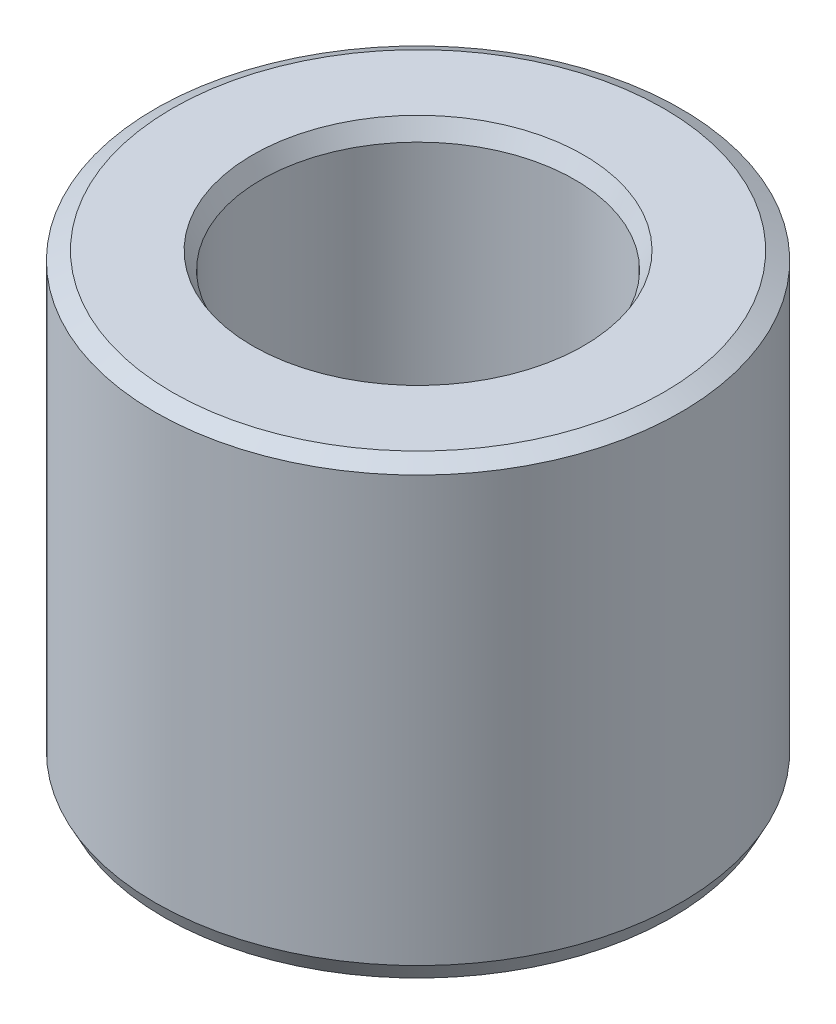
from build123d import *
from OCP.BRepFilletAPI import BRepFilletAPI_MakeChamfer

# Parameters (mm, degrees)
SKETCH1_R           = 40
BOSS_EXTRUDE1_DEPTH = 68.575934322
SKETCH2_R           = 23.842682264
CUT_EXTRUDE1_DEPTH  = 89.896899654
CHAMFER1_SIZE       = 1.338896725
CHAMFER1_SIZE2      = 2.590322023


with BuildPart() as part:
    # Sketch1 → Boss-Extrude1 (new body)
    with BuildSketch(Plane(origin=(0, 0, 0), x_dir=(1, 0, 0), z_dir=(0, 1, 0))):
        Circle(SKETCH1_R)
    extrude(amount=BOSS_EXTRUDE1_DEPTH)

    # Sketch2 → Cut-Extrude1 (cut, through all)
    with BuildSketch(Plane(origin=(0, 0, 0), x_dir=(1, 0, 0), z_dir=(0, 1, 0))):
        Circle(SKETCH2_R)
    extrude(amount=CUT_EXTRUDE1_DEPTH, mode=Mode.SUBTRACT)

    # Chamfer1: one chamfer whose edges measure the first distance from different faces: ONE call of the kernel's chamfer builder (chamfer() names one face for all edges)
    chamfer1_edges_1 = [part.edges().sort_by_distance(p)[0] for p in [
        (-23.842682264, 68.575934322, 0),
    ]]
    chamfer1_side_1 = [part.faces().sort_by_distance(p)[0] for p in [
        (-38.86862915, 68.575934322, 0),
    ]]
    chamfer1_edges_2 = [part.edges().sort_by_distance(p)[0] for p in [
        (-23.842682264, 0, 0),
    ]]
    chamfer1_side_2 = [part.faces().sort_by_distance(p)[0] for p in [
        (-23.842682264, 34.287967161, 0),
    ]]
    chamfer1_edges_3 = [part.edges().sort_by_distance(p)[0] for p in [
        (-40, 0, 0),
    ]]
    chamfer1_side_3 = [part.faces().sort_by_distance(p)[0] for p in [
        (-38.86862915, 0, 0),
    ]]
    chamfer1_edges_4 = [part.edges().sort_by_distance(p)[0] for p in [
        (-40, 68.575934322, 0),
    ]]
    chamfer1_side_4 = [part.faces().sort_by_distance(p)[0] for p in [
        (-40, 34.287967161, 0),
    ]]
    chamfer1 = BRepFilletAPI_MakeChamfer(part.part.solid().wrapped)
    for e in chamfer1_edges_1:
        chamfer1.Add(CHAMFER1_SIZE, CHAMFER1_SIZE2, e.wrapped, chamfer1_side_1[0].wrapped)  # the first distance lies on this face
    for e in chamfer1_edges_2:
        chamfer1.Add(CHAMFER1_SIZE, CHAMFER1_SIZE2, e.wrapped, chamfer1_side_2[0].wrapped)  # the first distance lies on this face
    for e in chamfer1_edges_3:
        chamfer1.Add(CHAMFER1_SIZE, CHAMFER1_SIZE2, e.wrapped, chamfer1_side_3[0].wrapped)  # the first distance lies on this face
    for e in chamfer1_edges_4:
        chamfer1.Add(CHAMFER1_SIZE, CHAMFER1_SIZE2, e.wrapped, chamfer1_side_4[0].wrapped)  # the first distance lies on this face
    add(Compound.cast(chamfer1.Shape()), mode=Mode.REPLACE)


solid = part.part
